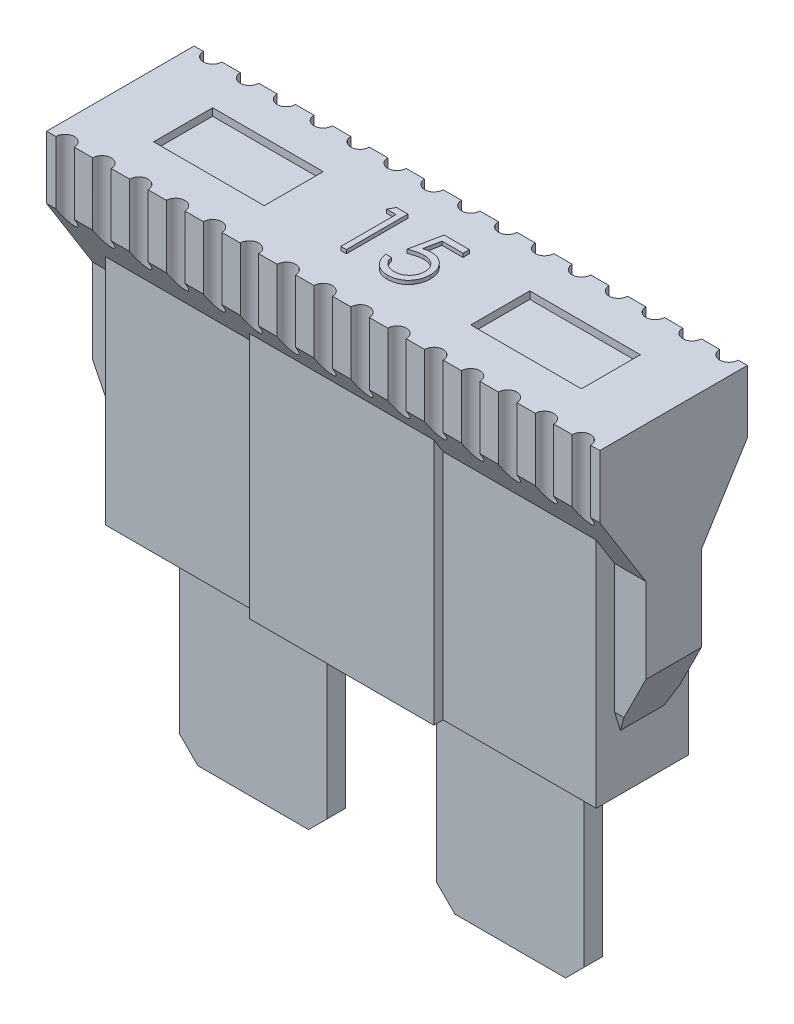
from build123d import *

# Parameters (mm, degrees)
BOSS_EXTRUDE1_DEPTH     = 9.525
SKETCH2_W               = 3.175
SKETCH2_H               = 8.001
BOSS_EXTRUDE2_DEPTH     = 8.4455
SKETCH4_R               = 0.3175
CUT_EXTRUDE1_DEPTH      = 16.287023288
SKETCH5_W               = 6.35
SKETCH5_H               = 3.81
BOSS_EXTRUDE3_DEPTH     = 9.271
SKETCH6_W               = 3.81
SKETCH6_H               = 2.032
CUT_EXTRUDE2_DEPTH      = 0.254
SKETCH7_W               = 5.08
SKETCH7_H               = 0.635
BOSS_EXTRUDE4_DEPTH     = 6.858
BOSS_EXTRUDE4_2_DEPTH   = 6.858
CHAMFER1_SIZE           = 0.635
CHAMFER4_SIZE           = 0.635
CHAMFER2_SIZE           = 2.54
CHAMFER2_SIZE_2         = 1.27
CHAMFER3_SIZE           = 1.27
CHAMFER3_SIZE_2         = 2.54
BOSS_EXTRUDE5_DEPTH     = 0.127
SKETCH10_W              = 5.588
SKETCH10_H              = 0.635
BOSS_EXTRUDE6_DEPTH     = 8.89
BOSS_EXTRUDE7_DEPTH     = 0.254
CUT_EXTRUDE3_DEPTH      = 18.163367734
CUT_EXTRUDE3_DEPTH_BACK = 18.163367734
SKETCH13_W              = 1.905
SKETCH13_H              = 1.27
SKETCH14_W              = 2.264072734
SKETCH14_H              = 1.852783177
CUT_EXTRUDE4_DEPTH      = 18.163367734


with BuildPart() as part:
    # Sketch1 → Boss-Extrude1 (new, symmetric)
    with BuildSketch(Plane(origin=(0, 0, 0), x_dir=(0, 0, -1), z_dir=(1, 0, 0))):
        Polygon((-2.54, 4.553066579), (2.54, 4.553066579), (2.54, 2.394066579), (0.9525, -0.145933421), (0.9525, -4.579815385), (0.635, -5.606933421), (-0.635, -5.606933421), (-0.9525, -4.579815385), (-0.9525, -0.145933421), (-2.54, 2.394066579), align=None)
    extrude(amount=BOSS_EXTRUDE1_DEPTH, both=True)

    # Sketch2 → Boss-Extrude2 (add, symmetric)
    with BuildSketch(Plane(origin=(0, 0, 0), x_dir=(0, 0, -1), z_dir=(1, 0, 0))):
        with Locations((0, -3.130433421)):
            Rectangle(SKETCH2_W, SKETCH2_H)
    extrude(amount=BOSS_EXTRUDE2_DEPTH, both=True)

    # Sketch4 → Cut-Extrude1 (cut, through all)
    with BuildSketch(Plane(origin=(0, 4.553066579, 0), x_dir=(1, 0, 0), z_dir=(0, 1, 0))):
        with Locations((0, 2.54)):
            Circle(SKETCH4_R)
        with Locations((0, -2.54)):
            Circle(SKETCH4_R)
        with Locations((1.27, -2.54)):
            Circle(SKETCH4_R)
        with Locations((1.27, 2.54)):
            Circle(SKETCH4_R)
        with Locations((2.54, -2.54)):
            Circle(SKETCH4_R)
        with Locations((2.54, 2.54)):
            Circle(SKETCH4_R)
        with Locations((3.81, -2.54)):
            Circle(SKETCH4_R)
        with Locations((3.81, 2.54)):
            Circle(SKETCH4_R)
        with Locations((5.08, -2.54)):
            Circle(SKETCH4_R)
        with Locations((5.08, 2.54)):
            Circle(SKETCH4_R)
        with Locations((6.35, -2.54)):
            Circle(SKETCH4_R)
        with Locations((6.35, 2.54)):
            Circle(SKETCH4_R)
        with Locations((7.62, -2.54)):
            Circle(SKETCH4_R)
        with Locations((7.62, 2.54)):
            Circle(SKETCH4_R)
        with Locations((8.89, -2.54)):
            Circle(SKETCH4_R)
        with Locations((8.89, 2.54)):
            Circle(SKETCH4_R)
        with Locations((-1.27, -2.54)):
            Circle(SKETCH4_R)
        with Locations((-1.27, 2.54)):
            Circle(SKETCH4_R)
        with Locations((-2.54, -2.54)):
            Circle(SKETCH4_R)
        with Locations((-2.54, 2.54)):
            Circle(SKETCH4_R)
        with Locations((-3.81, -2.54)):
            Circle(SKETCH4_R)
        with Locations((-3.81, 2.54)):
            Circle(SKETCH4_R)
        with Locations((-5.08, -2.54)):
            Circle(SKETCH4_R)
        with Locations((-5.08, 2.54)):
            Circle(SKETCH4_R)
        with Locations((-6.35, -2.54)):
            Circle(SKETCH4_R)
        with Locations((-6.35, 2.54)):
            Circle(SKETCH4_R)
        with Locations((-7.62, -2.54)):
            Circle(SKETCH4_R)
        with Locations((-7.62, 2.54)):
            Circle(SKETCH4_R)
        with Locations((-8.89, -2.54)):
            Circle(SKETCH4_R)
        with Locations((-8.89, 2.54)):
            Circle(SKETCH4_R)
    extrude(amount=-CUT_EXTRUDE1_DEPTH, mode=Mode.SUBTRACT)

    # Sketch5 → Boss-Extrude3 (add)
    with BuildSketch(Plane.XZ.offset(7.130933421)):
        Rectangle(SKETCH5_W, SKETCH5_H)
    extrude(amount=-BOSS_EXTRUDE3_DEPTH)

    # Sketch6 → Cut-Extrude2 (cut)
    with BuildSketch(Plane(origin=(0, 4.553066579, 0), x_dir=(1, 0, 0), z_dir=(0, 1, 0))):
        with Locations((-5.461, 0)):
            Rectangle(SKETCH6_W, SKETCH6_H)
        with Locations((5.461, 0)):
            Rectangle(SKETCH6_W, SKETCH6_H)
    extrude(amount=-CUT_EXTRUDE2_DEPTH, mode=Mode.SUBTRACT)

    # Chamfer2
    # the kernel refuses this chamfer: 2.54, 1.27 mm, written as the material it takes off along each edge
    with BuildSketch(Plane(origin=(-9.525, -5.606933421, -7.213165339), x_dir=(-0.017268075123668392, 0.9998508956747116, 0), z_dir=(0, 0, 1))) as chamfer2_piece_1_section:
        Polygon((CHAMFER2_SIZE * 0.999850895675, -CHAMFER2_SIZE * 0.0172680751237), (-CHAMFER2_SIZE_2 * 0.0172680751237, -CHAMFER2_SIZE_2 * 0.999850895675), (0, 0), align=None)
    chamfer2_piece_1 = extrude(amount=14.426330679, mode=Mode.PRIVATE)
    chamfer2_piece_1 = split(chamfer2_piece_1, bisect_by=Plane(origin=(-8.4455, -4.722125627, 0), z_dir=(-1, 0, 0)), keep=Keep.TOP, mode=Mode.PRIVATE)
    add(chamfer2_piece_1, mode=Mode.SUBTRACT)

    # Chamfer3
    # the kernel refuses this chamfer: 2.54, 1.27 mm, written as the material it takes off along each edge
    with BuildSketch(Plane(origin=(9.525, -5.606933421, -7.213165339), x_dir=(-0.9976223042390326, -0.06891834360170848, 0), z_dir=(0, 0, 1))) as chamfer3_piece_1_section:
        Polygon((CHAMFER3_SIZE * 0.997622304239, -CHAMFER3_SIZE * 0.0689183436017), (-CHAMFER3_SIZE_2 * 0.0689183436017, -CHAMFER3_SIZE_2 * 0.997622304239), (0, 0), align=None)
    chamfer3_piece_1 = extrude(amount=14.426330679, mode=Mode.PRIVATE)
    chamfer3_piece_1 = split(chamfer3_piece_1, bisect_by=Plane(origin=(8.4455, -4.722125627, 0), z_dir=(1, 0, 0)), keep=Keep.TOP, mode=Mode.PRIVATE)
    add(chamfer3_piece_1, mode=Mode.SUBTRACT)

    # Sketch8 → Boss-Extrude5 (add)
    with BuildSketch(Plane(origin=(0, 4.553066579, 0), x_dir=(1, 0, 0), z_dir=(0, 1, 0))):
        Polygon((-1.096918403, 1.079764041), (-0.705555556, 1.079764041), (-0.705555556, -1.036902626), (-0.895512821, -1.036902626), (-0.895512821, 0.862670024), (-1.221153846, 0.862670024), align=None)
        with BuildLine():
            Line((1.411111111, 1.079764041), (1.411111111, 0.862670024))
            Line((1.411111111, 0.862670024), (0.691139156, 0.862670024))
            Line((0.691139156, 0.862670024), (0.577079995, 0.305942593))
            add(Edge.make_bspline(
                [(0.577079995, 0.305942593), (0.599489976, 0.312129472), (0.64290577, 0.324115571), (0.706986257, 0.337423823), (0.76782059, 0.345446258), (0.807296647, 0.346541669), (0.826398905, 0.347071733)],
                knots=[0, 0, 0, 0, 1.100273476, 2.13160584, 3.095893838, 4, 4, 4, 4], degree=3))
            add(Edge.make_bspline(
                [(0.826398905, 0.347071733), (0.850035262, 0.346560144), (0.896510245, 0.34555423), (0.964509037, 0.335895064), (1.029419882, 0.320691402), (1.091107029, 0.299451848), (1.1496846, 0.272292152), (1.204613649, 0.238365046), (1.256718673, 0.198732983), (1.305064908, 0.15316719), (1.348924847, 0.103019356), (1.387488089, 0.049100072), (1.42024356, -0.008066657), (1.446587445, -0.069027026), (1.467623685, -0.133107085), (1.48162513, -0.200981075), (1.490948568, -0.272009224), (1.491990202, -0.320574369), (1.492521368, -0.345339458)],
                knots=[0, 0, 0, 0, 1.052922333, 2.070308379, 3.05430497, 4.020497103, 4.973039431, 5.925935799, 6.892292201, 7.88610001, 8.88166317, 9.857072816, 10.836096531, 11.812156883, 12.81219415, 13.836441305, 14.89672472, 16, 16, 16, 16], degree=3))
            add(Edge.make_bspline(
                [(1.492521368, -0.345339458), (1.492119155, -0.36258861), (1.491320167, -0.396853808), (1.487257021, -0.447741015), (1.479433992, -0.497550918), (1.468930654, -0.546290127), (1.455297859, -0.593866366), (1.438794479, -0.640415814), (1.418597833, -0.685648743), (1.396444573, -0.729993148), (1.371500274, -0.772446531), (1.343815177, -0.812148537), (1.314565571, -0.849694746), (1.283092923, -0.88468248), (1.249104702, -0.916881828), (1.213012532, -0.946483884), (1.175104411, -0.97398926), (1.13479386, -0.998281455), (1.09297912, -1.020635242), (1.049056341, -1.038973763), (1.004025346, -1.055369177), (0.957238017, -1.068437796), (0.90880033, -1.07867796), (0.858632442, -1.085633085), (0.806997466, -1.090698836), (0.771996863, -1.091015947), (0.754316907, -1.09117613)],
                knots=[0, 0, 0, 0, 1.056347294, 2.098418968, 3.122841568, 4.141288669, 5.149314143, 6.15115421, 7.162517403, 8.180376062, 9.185164535, 10.17417709, 11.141909838, 12.097768115, 13.052685741, 14.0056014, 14.954263652, 15.917497458, 16.885230207, 17.854509472, 18.828990115, 19.81800267, 20.826176721, 21.857883937, 22.917946725, 24, 24, 24, 24], degree=3))
            add(Edge.make_bspline(
                [(0.754316907, -1.09117613), (0.733226331, -1.090758337), (0.691733114, -1.08993638), (0.630942105, -1.081337582), (0.572452796, -1.069022261), (0.51673602, -1.050494612), (0.463292446, -1.027279439), (0.412841565, -0.997938706), (0.364094262, -0.964689439), (0.319032221, -0.925452273), (0.277209238, -0.88256517), (0.23977054, -0.83602412), (0.206427853, -0.786597267), (0.17771512, -0.734044574), (0.15322346, -0.678504129), (0.133982967, -0.619767838), (0.118453676, -0.558142598), (0.111883893, -0.515716427), (0.108547009, -0.494167583)],
                knots=[0, 0, 0, 0, 1.0467383, 2.05933395, 3.04377827, 4.011590433, 4.970194871, 5.932262533, 6.905835911, 7.896367577, 8.894135286, 9.877477877, 10.858688626, 11.851381753, 12.8477658, 13.868841284, 14.917554742, 16, 16, 16, 16], degree=3))
            Line((0.108547009, -0.494167583), (0.298504274, -0.494167583))
            add(Edge.make_bspline(
                [(0.298504274, -0.494167583), (0.303178211, -0.51435239), (0.312161777, -0.55314871), (0.331880492, -0.607656711), (0.355989855, -0.656230718), (0.384658199, -0.699513276), (0.418857503, -0.73725586), (0.457882443, -0.77089094), (0.50163559, -0.801234947), (0.550254353, -0.826527763), (0.601546072, -0.848098866), (0.655229099, -0.862462987), (0.709841728, -0.87256305), (0.746779599, -0.873574068), (0.765341213, -0.874082113)],
                knots=[0, 0, 0, 0, 1.136247022, 2.183929868, 3.172523383, 4.106158343, 5.02341133, 5.958108904, 6.928429099, 7.938127109, 8.96079061, 9.975095812, 10.982467395, 12, 12, 12, 12], degree=3))
            add(Edge.make_bspline(
                [(0.765341213, -0.874082113), (0.783458939, -0.873585738), (0.819132889, -0.872608371), (0.871633109, -0.86508573), (0.922319942, -0.853499961), (0.970693248, -0.836161525), (1.017599513, -0.815088766), (1.061852222, -0.788046792), (1.104731581, -0.756925733), (1.144904785, -0.721271009), (1.181698166, -0.681979813), (1.214207821, -0.639962532), (1.241287192, -0.595139487), (1.264107344, -0.548286676), (1.281435767, -0.498890596), (1.293797694, -0.447182742), (1.301056687, -0.393035397), (1.302055257, -0.356103005), (1.302564103, -0.337283235)],
                knots=[0, 0, 0, 0, 1.027316725, 2.022795036, 3.002884548, 3.971462791, 4.93288096, 5.914575861, 6.907176829, 7.935150275, 8.956128384, 9.956726525, 10.942570165, 11.921478529, 12.907843606, 13.90538589, 14.932640048, 16, 16, 16, 16], degree=3))
            add(Edge.make_bspline(
                [(1.302564103, -0.337283235), (1.302165879, -0.32030409), (1.301386414, -0.287069829), (1.295017926, -0.238447452), (1.283940519, -0.192441374), (1.268565125, -0.148829432), (1.249043708, -0.107570493), (1.225188081, -0.068621976), (1.19655055, -0.032497229), (1.163837837, 0.000820648), (1.128000831, 0.031569692), (1.088422949, 0.057782544), (1.045932421, 0.079834532), (1.001041187, 0.098865179), (0.952681463, 0.112533249), (0.901810928, 0.122794779), (0.847880252, 0.128730737), (0.811007503, 0.129554355), (0.792053953, 0.129977716)],
                knots=[0, 0, 0, 0, 1.045622112, 2.046656509, 3.013763289, 3.955457236, 4.890082067, 5.820317437, 6.762574623, 7.722996705, 8.69280354, 9.665887285, 10.63943826, 11.638615906, 12.663482002, 13.728887084, 14.832589034, 16, 16, 16, 16], degree=3))
            add(Edge.make_bspline(
                [(0.792053953, 0.129977716), (0.77564741, 0.129626597), (0.741772062, 0.128901624), (0.68980921, 0.123563695), (0.635204215, 0.114952312), (0.578166401, 0.103107296), (0.518524475, 0.087606597), (0.456404299, 0.069031637), (0.391675262, 0.046823572), (0.34806121, 0.030052185), (0.325641026, 0.021430708)],
                knots=[0, 0, 0, 0, 0.817624296, 1.688186739, 2.600797293, 3.572016777, 4.590301741, 5.671205678, 6.80286297, 8, 8, 8, 8], degree=3))
            Line((0.325641026, 0.021430708), (0.542735043, 1.079764041))
            Line((0.542735043, 1.079764041), (1.411111111, 1.079764041))
        make_face()
    extrude(amount=BOSS_EXTRUDE5_DEPTH)


with BuildPart() as body_2:
    # Sketch7 → Boss-Extrude4 (new body)
    with BuildSketch(Plane.XZ.offset(7.130933421)):
        with Locations((-4.633336117, 0)):
            Rectangle(SKETCH7_W, SKETCH7_H)
    extrude(amount=BOSS_EXTRUDE4_DEPTH)

    # Chamfer1
    chamfer1_edges = [body_2.edges().sort_by_distance(p)[0] for p in [
        (-7.173336117, -13.988933421, 0),
        (-2.093336117, -13.988933421, 0),
    ]]
    chamfer(chamfer1_edges, length=CHAMFER1_SIZE)


with BuildPart() as body_3:
    # Sketch7 → Boss-Extrude4 2 (new body)
    with BuildSketch(Plane.XZ.offset(7.130933421)):
        with Locations((4.217708194, 0)):
            Rectangle(SKETCH7_W, SKETCH7_H)
    extrude(amount=BOSS_EXTRUDE4_2_DEPTH)

    # Chamfer4
    chamfer4_edges = [body_3.edges().sort_by_distance(p)[0] for p in [
        (1.677708194, -13.988933421, 0),
        (6.757708194, -13.988933421, 0),
    ]]
    chamfer(chamfer4_edges, length=CHAMFER4_SIZE)


    add(body_2.part)  # Boss-Extrude6 merges body 2
    # Sketch10 → Boss-Extrude6 (add)
    with BuildSketch(Plane(origin=(0, -7.130933421, 0), x_dir=(1, 0, 0), z_dir=(0, 1, 0))):
        with Locations((4.217708194, 0)):
            Rectangle(SKETCH10_W, SKETCH10_H)
        with Locations((-4.633336117, 0)):
            Rectangle(SKETCH10_W, SKETCH10_H)
    extrude(amount=BOSS_EXTRUDE6_DEPTH)

    # Sketch12 → Boss-Extrude7 (add, symmetric)
    with BuildSketch(Plane.XY):
        with BuildLine():
            Line((-1.835806538, -4.727085913), (-1.835806538, -5.235128734))
            ThreePointArc((-1.835806538, -5.235128734), (-1.065137128, -4.915907012), (-0.745915406, -4.145237602))
            Line((-0.745915406, -4.145237602), (-0.745915406, -1.199696548))
            ThreePointArc((-0.745915406, -1.199696548), (-0.204284382, -0.658065524), (0.337346642, -1.199696548))
            Line((0.337346642, -1.199696548), (0.337346642, -4.145237602))
            ThreePointArc((0.337346642, -4.145237602), (0.654624613, -4.918804763), (1.423708194, -5.246801575))
            Line((1.423708194, -5.246801575), (1.423708194, -4.738850624))
            ThreePointArc((1.423708194, -4.738850624), (1.009262878, -4.562099039), (0.838287483, -4.145237602))
            Line((0.838287483, -4.145237602), (0.838287483, -1.199696548))
            ThreePointArc((0.838287483, -1.199696548), (-0.211343541, -0.150065524), (-1.260974565, -1.199696548))
            Line((-1.260974565, -1.199696548), (-1.260974565, -4.145237602))
            ThreePointArc((-1.260974565, -4.145237602), (-1.428918266, -4.554193362), (-1.835806538, -4.727085913))
        make_face()
    extrude(amount=BOSS_EXTRUDE7_DEPTH, both=True)

    # Sketch13 → Cut-Extrude3 (cut, two sides: drawn at the far end of the back side and taken through both)
    with BuildSketch(Plane.XY.offset(0.3175).offset(-CUT_EXTRUDE3_DEPTH_BACK)):
        with Locations((-2.791836117, 1.124066579)):
            Rectangle(SKETCH13_W, SKETCH13_H)
        with Locations((2.376208194, 1.124066579)):
            Rectangle(SKETCH13_W, SKETCH13_H)
    extrude(amount=CUT_EXTRUDE3_DEPTH + CUT_EXTRUDE3_DEPTH_BACK, mode=Mode.SUBTRACT)

    # Sketch14 → Cut-Extrude4 (cut, through all)
    with BuildSketch(Plane.XY.offset(0.3175)):
        with Locations((-4.559388299, -4.933000833)):
            Rectangle(SKETCH14_W, SKETCH14_H)
        with Locations((4.217708194, -4.933000833)):
            Rectangle(SKETCH14_W, SKETCH14_H)
    extrude(amount=-CUT_EXTRUDE4_DEPTH, mode=Mode.SUBTRACT)


solid = Compound([part.part, body_3.part])
